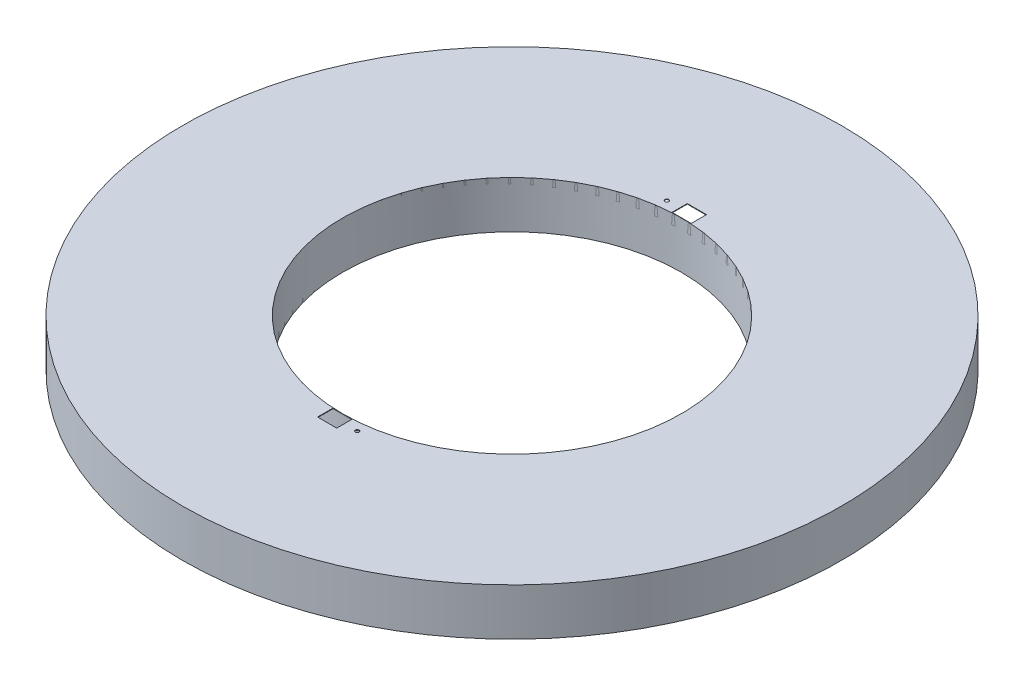
from build123d import *

# Parameters (mm, degrees)
SKETCH1_R               = 1750
BOSS_EXTRUDE1_DEPTH     = 500
SKETCH2_R               = 900
CUT_EXTRUDE2_DEPTH      = 300
SKETCH3_R               = 600
CUT_EXTRUDE3_DEPTH      = 300
SKETCH4_R               = 1748.5
SKETCH4_R_2             = 900.75
CUT_EXTRUDE5_DEPTH      = 497
CUT_EXTRUDE6_DEPTH      = 2525.876234591
CUT_EXTRUDE6_DEPTH_BACK = 2525.876234591
SKETCH5_W               = 3500
SKETCH5_H               = 250
CUT_EXTRUDE7_DEPTH      = 10
CIRPATTERN1_COUNT       = 2
SKETCH7_R               = 10
CUT_EXTRUDE8_DEPTH      = 10


with BuildPart() as part:
    # Sketch1 → Boss-Extrude1 (new body)
    with BuildSketch(Plane(origin=(0, 0, 0), x_dir=(1, 0, 0), z_dir=(0, 1, 0))):
        Circle(SKETCH1_R)
    extrude(amount=BOSS_EXTRUDE1_DEPTH)

    # Sketch2 → Cut-Extrude2 (cut)
    with BuildSketch(Plane(origin=(0, 500, 0), x_dir=(1, 0, 0), z_dir=(0, 1, 0))):
        Circle(SKETCH2_R)
    extrude(amount=-CUT_EXTRUDE2_DEPTH, mode=Mode.SUBTRACT)

    # Sketch3 → Cut-Extrude3 (cut)
    with BuildSketch(Plane.XZ):
        Circle(SKETCH3_R)
    extrude(amount=-CUT_EXTRUDE3_DEPTH, mode=Mode.SUBTRACT)

    # Sketch4 → Cut-Extrude5 (cut)
    with BuildSketch(Plane(origin=(0, 0, 0), x_dir=(-1, 0, 0), z_dir=(0, -1, 0))):
        Circle(SKETCH4_R)
        Circle(SKETCH4_R_2, mode=Mode.SUBTRACT)
    extrude(amount=-CUT_EXTRUDE5_DEPTH, mode=Mode.SUBTRACT)

    # Sketch5 → Cut-Extrude6 (cut, two sides: drawn at the far end of the back side and taken through both)
    with BuildSketch(Plane.XY.offset(-CUT_EXTRUDE6_DEPTH_BACK)):
        with Locations((0, 125)):
            Rectangle(SKETCH5_W, SKETCH5_H)
    extrude(amount=CUT_EXTRUDE6_DEPTH + CUT_EXTRUDE6_DEPTH_BACK, mode=Mode.SUBTRACT)

    # Sketch6 → Cut-Extrude7 (cut)
    with BuildSketch(Plane.XZ.offset(-497)):
        Polygon((0, 900.75), (51, 900.75), (51, 981.75), (-51, 981.75), (-51, 900.75), align=None)
    cut_extrude7 = extrude(amount=-CUT_EXTRUDE7_DEPTH, mode=Mode.SUBTRACT)

    # CirPattern1: Cut-Extrude7 ×2 about axis
    cirpattern1_axis = Axis((0, 497, 0), (0, -1, 0))
    for i in range(1, CIRPATTERN1_COUNT):
        add(cut_extrude7.rotate(cirpattern1_axis, i * 360 / CIRPATTERN1_COUNT), mode=Mode.SUBTRACT)

    # Sketch7 → Cut-Extrude8 (cut)
    with BuildSketch(Plane.XZ.offset(-497)):
        with Locations((-118.818630958, -941.25)):
            Circle(SKETCH7_R)
        with Locations((119.300731455, 941.189016636)):
            Circle(SKETCH7_R)
    extrude(amount=-CUT_EXTRUDE8_DEPTH, mode=Mode.SUBTRACT)


solid = part.part
